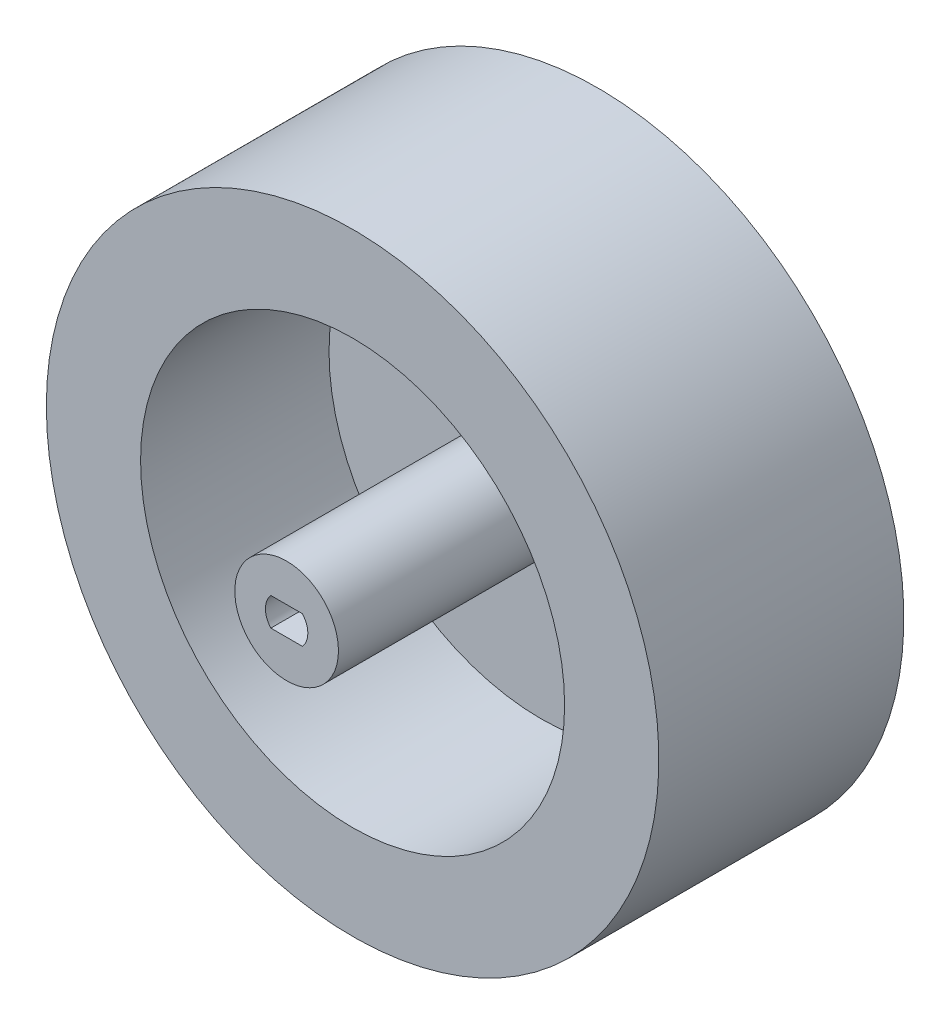
from build123d import *

# Parameters (mm, degrees)
SKETCH1_R           = 32.5
BOSS_EXTRUDE1_DEPTH = 26
SKETCH2_R           = 22.5
CUT_EXTRUDE1_DEPTH  = 20
SKETCH3_R           = 5.5
BOSS_EXTRUDE2_DEPTH = 27
CUT_EXTRUDE2_DEPTH  = 24.3


with BuildPart() as part:
    # Sketch1 → Boss-Extrude1 (new body)
    with BuildSketch(Plane.XY):
        Circle(SKETCH1_R)
    extrude(amount=BOSS_EXTRUDE1_DEPTH)

    # Sketch2 → Cut-Extrude1 (cut)
    with BuildSketch(Plane.XY.offset(26)):
        Circle(SKETCH2_R)
    extrude(amount=-CUT_EXTRUDE1_DEPTH, mode=Mode.SUBTRACT)

    # Sketch3 → Boss-Extrude2 (add)
    with BuildSketch(Plane.XY.offset(6)):
        Circle(SKETCH3_R)
    extrude(amount=BOSS_EXTRUDE2_DEPTH)

    # Sketch4 → Cut-Extrude2 (cut)
    with BuildSketch(Plane.XY.offset(33)):
        with BuildLine():
            ThreePointArc((-1.677050983, 1.5), (-2.25, 0), (-1.677050983, -1.5))
            Line((-1.677050983, -1.5), (1.677050983, -1.5))
            ThreePointArc((1.677050983, -1.5), (2.25, 0), (1.677050983, 1.5))
            Line((1.677050983, 1.5), (-1.677050983, 1.5))
        make_face()
    extrude(amount=-CUT_EXTRUDE2_DEPTH, mode=Mode.SUBTRACT)


solid = part.part
